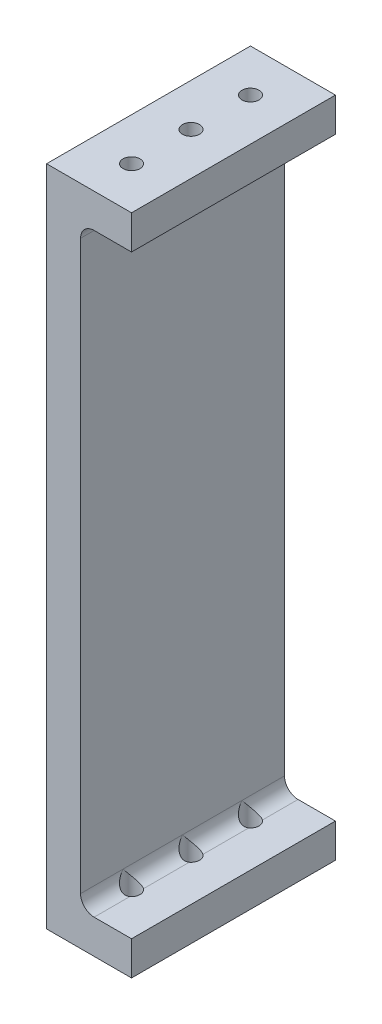
from build123d import *

# Parameters (mm, degrees)
BOSS_EXTRUDE1_DEPTH = 38.1
SKETCH2_R           = 1.5875
CUT_EXTRUDE1_DEPTH  = 130.796935754
FILLET2_R           = 2.54


with BuildPart() as part:
    # Sketch1 → Boss-Extrude1 (new body)
    with BuildSketch(Plane.XY):
        Polygon((-7.9375, -61.9125), (7.9375, -61.9125), (7.9375, -55.5625), (-1.5875, -55.5625), (-1.5875, 55.5625), (7.9375, 55.5625), (7.9375, 61.9125), (-7.9375, 61.9125), align=None)
    extrude(amount=BOSS_EXTRUDE1_DEPTH)

    # Sketch2 → Cut-Extrude1 (cut, through all)
    with BuildSketch(Plane(origin=(0, 61.9125, 0), x_dir=(1, 0, 0), z_dir=(0, 1, 0))):
        with Locations(Location((0, -7.9375, 0), (0, 0, 270))):
            Circle(SKETCH2_R)
        with Locations(Location((0, -19.05, 0), (0, 0, 270))):
            Circle(SKETCH2_R)
        with Locations(Location((0, -30.1625, 0), (0, 0, 270))):
            Circle(SKETCH2_R)
    extrude(amount=-CUT_EXTRUDE1_DEPTH, mode=Mode.SUBTRACT)

    # Fillet2
    # the kernel refuses this fillet: 2.54 mm, written as the material it adds along each edge
    with BuildSketch(Plane(origin=(-1.5875, 55.5625, 30.1625), x_dir=(0, -1, 0), z_dir=(0, 0, 1))) as fillet2_piece_1_section:
        with BuildLine():
            CenterArc((FILLET2_R, FILLET2_R), FILLET2_R, 180, 90)
            Line((0, FILLET2_R), (0, 0))
            Line((0, 0), (FILLET2_R, 0))
        make_face()
    fillet2_piece_1 = extrude(amount=7.9375, mode=Mode.PRIVATE)
    fillet2_piece_1 = fillet2_piece_1 - Plane(origin=(0, 54.97769338, 30.1625), x_dir=(0, 0, 1), z_dir=(0, 1, 0)) * Cylinder(1.5875, 27, mode=Mode.PRIVATE)
    add(fillet2_piece_1)
    with BuildSketch(Plane(origin=(-1.5875, -55.5625, 30.1625), x_dir=(1, 0, 0), z_dir=(0, 0, 1))) as fillet2_piece_2_section:
        with BuildLine():
            CenterArc((FILLET2_R, FILLET2_R), FILLET2_R, 180, 90)
            Line((0, FILLET2_R), (0, 0))
            Line((0, 0), (FILLET2_R, 0))
        make_face()
    fillet2_piece_2 = extrude(amount=7.9375, mode=Mode.PRIVATE)
    fillet2_piece_2 = fillet2_piece_2 - Plane(origin=(0, -54.977693276, 30.1625), x_dir=(0, 0, 1), z_dir=(0, 1, 0)) * Cylinder(1.5875, 27, mode=Mode.PRIVATE)
    add(fillet2_piece_2)
    with BuildSketch(Plane(origin=(-1.5875, 55.5625, 19.05), x_dir=(0, -1, 0), z_dir=(0, 0, 1))) as fillet2_piece_3_section:
        with BuildLine():
            CenterArc((FILLET2_R, FILLET2_R), FILLET2_R, 180, 90)
            Line((0, FILLET2_R), (0, 0))
            Line((0, 0), (FILLET2_R, 0))
        make_face()
    fillet2_piece_3 = extrude(amount=11.1125, mode=Mode.PRIVATE)
    fillet2_piece_3 = fillet2_piece_3 - Plane(origin=(0, 54.968485011, 30.1625), x_dir=(0, 0, 1), z_dir=(0, 1, 0)) * Cylinder(1.5875, 33, mode=Mode.PRIVATE)
    fillet2_piece_3 = fillet2_piece_3 - Plane(origin=(0, 54.968485011, 19.05), x_dir=(0, 0, 1), z_dir=(0, 1, 0)) * Cylinder(1.5875, 33, mode=Mode.PRIVATE)
    add(fillet2_piece_3)
    with BuildSketch(Plane(origin=(-1.5875, 55.5625, 7.9375), x_dir=(0, -1, 0), z_dir=(0, 0, 1))) as fillet2_piece_4_section:
        with BuildLine():
            CenterArc((FILLET2_R, FILLET2_R), FILLET2_R, 180, 90)
            Line((0, FILLET2_R), (0, 0))
            Line((0, 0), (FILLET2_R, 0))
        make_face()
    fillet2_piece_4 = extrude(amount=11.1125, mode=Mode.PRIVATE)
    fillet2_piece_4 = fillet2_piece_4 - Plane(origin=(0, 54.968485011, 19.05), x_dir=(0, 0, 1), z_dir=(0, 1, 0)) * Cylinder(1.5875, 33, mode=Mode.PRIVATE)
    fillet2_piece_4 = fillet2_piece_4 - Plane(origin=(0, 54.968485011, 7.9375), x_dir=(0, 0, 1), z_dir=(0, 1, 0)) * Cylinder(1.5875, 33, mode=Mode.PRIVATE)
    add(fillet2_piece_4)
    with BuildSketch(Plane(origin=(-1.5875, 55.5625, 0), x_dir=(0, -1, 0), z_dir=(0, 0, 1))) as fillet2_piece_5_section:
        with BuildLine():
            CenterArc((FILLET2_R, FILLET2_R), FILLET2_R, 180, 90)
            Line((0, FILLET2_R), (0, 0))
            Line((0, 0), (FILLET2_R, 0))
        make_face()
    fillet2_piece_5 = extrude(amount=7.9375, mode=Mode.PRIVATE)
    fillet2_piece_5 = fillet2_piece_5 - Plane(origin=(0, 54.977693583, 7.9375), x_dir=(0, 0, 1), z_dir=(0, 1, 0)) * Cylinder(1.5875, 27, mode=Mode.PRIVATE)
    add(fillet2_piece_5)
    with BuildSketch(Plane(origin=(-1.5875, -55.5625, 19.05), x_dir=(1, 0, 0), z_dir=(0, 0, 1))) as fillet2_piece_6_section:
        with BuildLine():
            CenterArc((FILLET2_R, FILLET2_R), FILLET2_R, 180, 90)
            Line((0, FILLET2_R), (0, 0))
            Line((0, 0), (FILLET2_R, 0))
        make_face()
    fillet2_piece_6 = extrude(amount=11.1125, mode=Mode.PRIVATE)
    fillet2_piece_6 = fillet2_piece_6 - Plane(origin=(0, -54.968484791, 30.1625), x_dir=(0, 0, 1), z_dir=(0, 1, 0)) * Cylinder(1.5875, 33, mode=Mode.PRIVATE)
    fillet2_piece_6 = fillet2_piece_6 - Plane(origin=(0, -54.968484791, 19.05), x_dir=(0, 0, 1), z_dir=(0, 1, 0)) * Cylinder(1.5875, 33, mode=Mode.PRIVATE)
    add(fillet2_piece_6)
    with BuildSketch(Plane(origin=(-1.5875, -55.5625, 7.9375), x_dir=(1, 0, 0), z_dir=(0, 0, 1))) as fillet2_piece_7_section:
        with BuildLine():
            CenterArc((FILLET2_R, FILLET2_R), FILLET2_R, 180, 90)
            Line((0, FILLET2_R), (0, 0))
            Line((0, 0), (FILLET2_R, 0))
        make_face()
    fillet2_piece_7 = extrude(amount=11.1125, mode=Mode.PRIVATE)
    fillet2_piece_7 = fillet2_piece_7 - Plane(origin=(0, -54.968484789, 19.05), x_dir=(0, 0, 1), z_dir=(0, 1, 0)) * Cylinder(1.5875, 33, mode=Mode.PRIVATE)
    fillet2_piece_7 = fillet2_piece_7 - Plane(origin=(0, -54.968484789, 7.9375), x_dir=(0, 0, 1), z_dir=(0, 1, 0)) * Cylinder(1.5875, 33, mode=Mode.PRIVATE)
    add(fillet2_piece_7)
    with BuildSketch(Plane(origin=(-1.5875, -55.5625, 0), x_dir=(1, 0, 0), z_dir=(0, 0, 1))) as fillet2_piece_8_section:
        with BuildLine():
            CenterArc((FILLET2_R, FILLET2_R), FILLET2_R, 180, 90)
            Line((0, FILLET2_R), (0, 0))
            Line((0, 0), (FILLET2_R, 0))
        make_face()
    fillet2_piece_8 = extrude(amount=7.9375, mode=Mode.PRIVATE)
    fillet2_piece_8 = fillet2_piece_8 - Plane(origin=(0, -54.977693451, 7.9375), x_dir=(0, 0, 1), z_dir=(0, 1, 0)) * Cylinder(1.5875, 27, mode=Mode.PRIVATE)
    add(fillet2_piece_8)


solid = part.part
